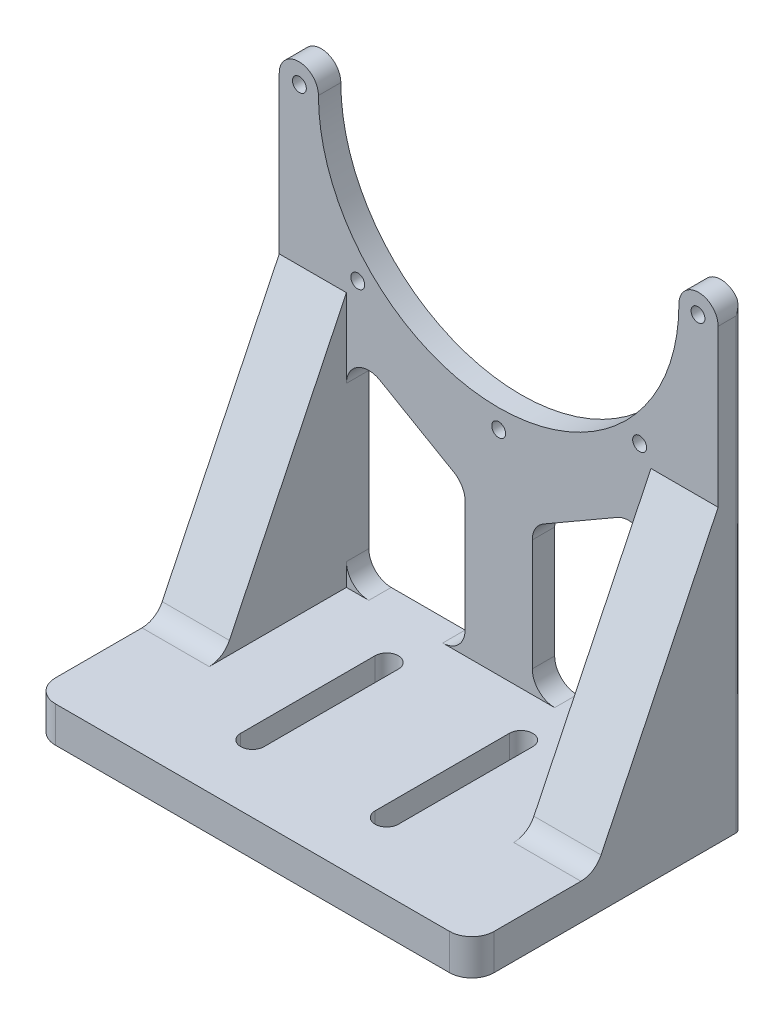
from build123d import *

# Parameters (mm, degrees)
SKETCH1_R           = 1.55
BOSS_EXTRUDE1_DEPTH = 5
SKETCH2_W           = 98
SKETCH2_H           = 8
BOSS_EXTRUDE2_DEPTH = 55
BOSS_EXTRUDE3_DEPTH = 15
FILLET2_R           = 5
CUT_EXTRUDE1_DEPTH  = 15
FILLET3_R           = 1


with BuildPart() as part:
    # Sketch1 → Boss-Extrude1 (new body)
    with BuildSketch(Plane.XY):
        with BuildLine():
            Line((-49, 0), (-49, -100))
            Line((-49, -100), (49, -100))
            Line((49, -100), (49, 0))
            ThreePointArc((49, 0), (44.625, 4.375), (40.25, 0))
            ThreePointArc((40.25, 0), (0, -40.25), (-40.25, 0))
            ThreePointArc((-40.25, 0), (-44.625, 4.375), (-49, 0))
        make_face()
        with Locations((0, -44.5)):
            Circle(SKETCH1_R, mode=Mode.SUBTRACT)
        with Locations((-31.466251763, -31.466251763)):
            Circle(SKETCH1_R, mode=Mode.SUBTRACT)
        with Locations((-44.5, 0)):
            Circle(SKETCH1_R, mode=Mode.SUBTRACT)
        with Locations((44.5, 0)):
            Circle(SKETCH1_R, mode=Mode.SUBTRACT)
        with Locations((31.466251763, -31.466251763)):
            Circle(SKETCH1_R, mode=Mode.SUBTRACT)
        with BuildLine():
            Line((-12.5, -92), (-29, -92))
            ThreePointArc((-29, -92), (-32.535533906, -90.535533906), (-34, -87))
            Line((-34, -87), (-34, -43.878620458))
            Line((-34, -43.878620458), (-10, -57.735026919))
            ThreePointArc((-10, -57.735026919), (-8.169872981, -59.565153938), (-7.5, -62.065153938))
            Line((-7.5, -62.065153938), (-7.5, -87))
            ThreePointArc((-7.5, -87), (-8.964466094, -90.535533906), (-12.5, -92))
        make_face(mode=Mode.SUBTRACT)
        with BuildLine():
            Line((10, -57.735026919), (34, -43.878620458))
            Line((34, -43.878620458), (34, -87))
            ThreePointArc((34, -87), (32.535533906, -90.535533906), (29, -92))
            Line((29, -92), (12.5, -92))
            ThreePointArc((12.5, -92), (8.964466094, -90.535533906), (7.5, -87))
            Line((7.5, -87), (7.5, -62.065153938))
            ThreePointArc((7.5, -62.065153938), (8.169872981, -59.565153938), (10, -57.735026919))
        make_face(mode=Mode.SUBTRACT)
    extrude(amount=BOSS_EXTRUDE1_DEPTH)

    # Sketch2 → Boss-Extrude2 (add)
    with BuildSketch(Plane.XY.offset(5)):
        with Locations((0, -96)):
            Rectangle(SKETCH2_W, SKETCH2_H)
    extrude(amount=BOSS_EXTRUDE2_DEPTH)

    # Sketch3 → Boss-Extrude3 (add)
    with BuildSketch(Plane(origin=(49, 0, 0), x_dir=(0, 0, -1), z_dir=(1, 0, 0))):
        Polygon((-5, -35), (-32.5, -92), (-5, -92), align=None)
    boss_extrude3 = extrude(amount=-BOSS_EXTRUDE3_DEPTH)

    # Mirror1: Boss-Extrude3 across plane
    add(boss_extrude3.mirror(Plane(origin=(0, 0, 0), x_dir=(0, 0, 1), z_dir=(1, 0, 0))))

    # Fillet2
    fillet2_edges = [part.edges().sort_by_distance(p)[0] for p in [
        (41.5, -92, 32.5),
        (-41.5, -92, 32.5),
        (-34, -43.878620458, 2.5),
        (34, -43.878620458, 2.5),
        (-49, -96, 60),
        (49, -96, 60),
    ]]
    fillet(fillet2_edges, radius=FILLET2_R)

    # Sketch4 → Cut-Extrude1 (cut)
    with BuildSketch(Plane(origin=(0, -92, 0), x_dir=(1, 0, 0), z_dir=(0, 1, 0))):
        with BuildLine():
            Line((-17.6, -45), (-17.6, -15))
            ThreePointArc((-17.6, -15), (-15, -12.4), (-12.4, -15))
            Line((-12.4, -15), (-12.4, -45))
            ThreePointArc((-12.4, -45), (-15, -47.6), (-17.6, -45))
        make_face()
        with BuildLine():
            Line((17.6, -45), (17.6, -15))
            ThreePointArc((17.6, -15), (15, -12.4), (12.4, -15))
            Line((12.4, -15), (12.4, -45))
            ThreePointArc((12.4, -45), (15, -47.6), (17.6, -45))
        make_face()
    extrude(amount=-CUT_EXTRUDE1_DEPTH, mode=Mode.SUBTRACT)

    # Fillet3
    # the kernel refuses this fillet: 1 mm, written as the material it takes off along each edge
    with BuildSketch(Plane(origin=(49, -106, 0), x_dir=(-1, 0, 0), z_dir=(0, 1, 0))) as fillet3_piece_1:
        with BuildLine():
            CenterArc((FILLET3_R, FILLET3_R), FILLET3_R, 180, 90)
            Line((0, FILLET3_R), (-FILLET3_R * 0.02, FILLET3_R))
            Line((-FILLET3_R * 0.02, FILLET3_R), (-FILLET3_R * 0.02, -FILLET3_R * 0.02))
            Line((-FILLET3_R * 0.02, -FILLET3_R * 0.02), (FILLET3_R, -FILLET3_R * 0.02))
            Line((FILLET3_R, -FILLET3_R * 0.02), (FILLET3_R, 0))
        make_face()
    extrude(amount=112, mode=Mode.SUBTRACT)
    with BuildSketch(Plane(origin=(-49, 6, 0), x_dir=(0, 0, 1), z_dir=(0, -1, 0))) as fillet3_piece_2:
        with BuildLine():
            CenterArc((FILLET3_R, -FILLET3_R), FILLET3_R, 90, 90)
            Line((0, -FILLET3_R), (-FILLET3_R * 0.02, -FILLET3_R))
            Line((-FILLET3_R * 0.02, -FILLET3_R), (-FILLET3_R * 0.02, FILLET3_R * 0.02))
            Line((-FILLET3_R * 0.02, FILLET3_R * 0.02), (FILLET3_R, FILLET3_R * 0.02))
            Line((FILLET3_R, FILLET3_R * 0.02), (FILLET3_R, 0))
        make_face()
    extrude(amount=112, mode=Mode.SUBTRACT)


solid = part.part
